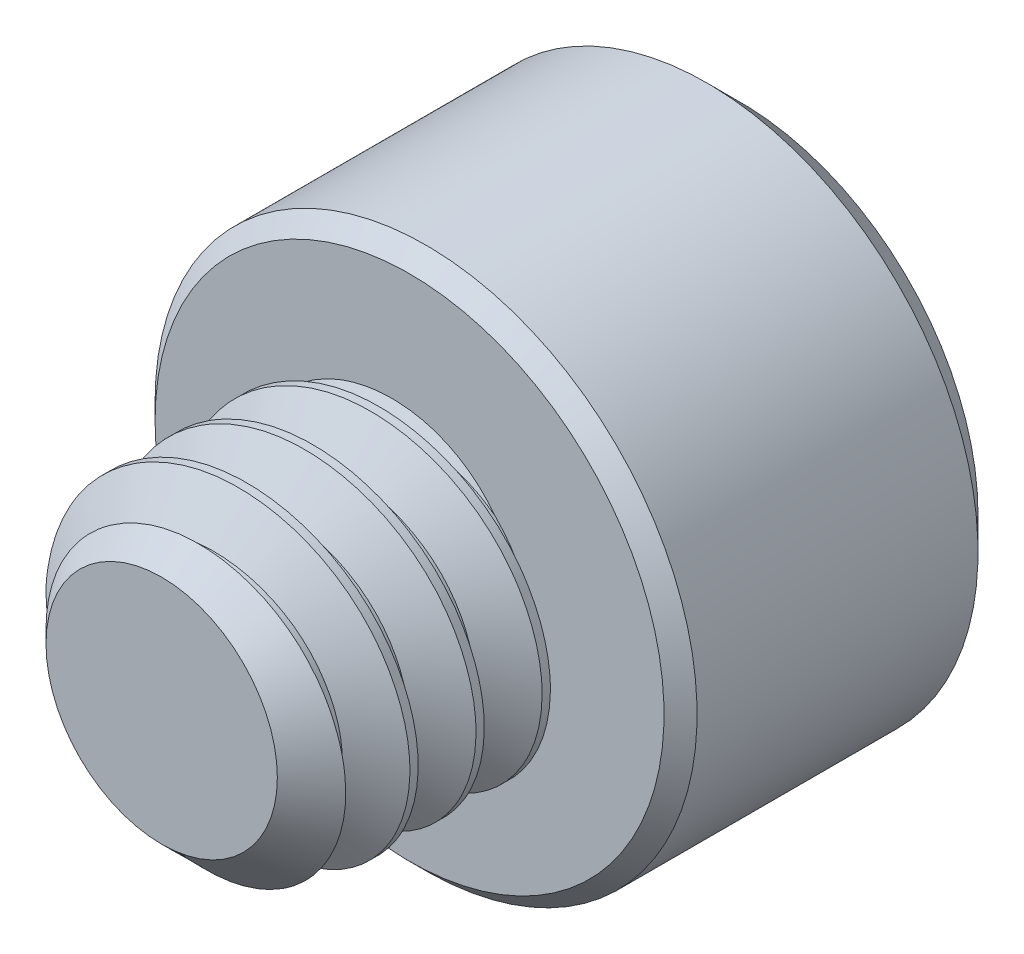
from build123d import *

# Parameters (mm, degrees)
SKETCH1_R          = 1.5875
EXTRUDE1_DEPTH     = 2.38125
CHAMFER3_SIZE      = 0.47625
CUT_SWEEP1_PITCH   = 0.635
SKETCH6_R          = 2.6035
EXTRUDE2_DEPTH     = 3.175
CUT_EXTRUDE1_DEPTH = 1.7859375
SKETCH8_R          = 1.374815329
CUT_EXTRUDE2_DEPTH = 0.3175
CUT_EXTRUDE2_DRAFT = -45
CHAMFER1_SIZE      = 0.3175
CHAMFER2_SIZE      = 0.15875


with BuildPart() as part:
    # Sketch1 → Extrude1 (new body)
    with BuildSketch(Plane.XY):
        Circle(SKETCH1_R)
    extrude(amount=-EXTRUDE1_DEPTH)

    # Chamfer3
    chamfer3_edges = [part.edges().sort_by_distance(p)[0] for p in [
        (-1.5875, 0, 0),
    ]]
    chamfer(chamfer3_edges, length=CHAMFER3_SIZE)

    # Cut-Sweep1: the profile of Sketch3 profile screwed along a right-hand helix of 4.75 turns, 6 arcs to a turn; built about Z, then put on its axis
    cut_sweep1_z = Axis((0, 0, 0), (0, 0, 1))
    cut_sweep1_corners = [(1.5878, 0, -0.555798205), (1.175055401, 0, -0.3175), (1.175055401, 0, -0.238125), (1.5878, 0, 0.000173205)]
    with BuildLine(mode=Mode.PRIVATE) as cut_sweep1_profile:
        Line(cut_sweep1_corners[0], cut_sweep1_corners[1])
        Line(cut_sweep1_corners[1], cut_sweep1_corners[2])
        Line(cut_sweep1_corners[2], cut_sweep1_corners[3])
        Line(cut_sweep1_corners[3], cut_sweep1_corners[0])
    cut_sweep1_cap = Face(cut_sweep1_profile.wire())
    cut_sweep1_turn_angles = [0, 30, 60, 90, 120, 150, 180, 210, 240, 270, 300, 330, 360]
    cut_sweep1_turn_weights = [1, 0.8660254037844387, 1, 0.8660254037844387, 1, 0.8660254037844387, 1, 0.8660254037844387, 1, 0.8660254037844387, 1, 0.8660254037844387, 1]
    cut_sweep1_turn_rails = [Edge.make_bspline([Vector(p[0], p[1], 0).rotate(cut_sweep1_z, cut_sweep1_turn_angles[k]) / cut_sweep1_turn_weights[k] + Vector(0, 0, p[2] + CUT_SWEEP1_PITCH * cut_sweep1_turn_angles[k] / 360) for k in range(13)], [0, 0, 0, 1, 1, 2, 2, 3, 3, 4, 4, 5, 5, 6, 6, 6], 2, cut_sweep1_turn_weights) for p in cut_sweep1_corners]
    cut_sweep1_turn_sides = [Face.make_surface_from_curves(cut_sweep1_turn_rails[p[0]], cut_sweep1_turn_rails[p[1]]) for p in [(0, 1), (1, 2), (2, 3), (3, 0)]]
    cut_sweep1_last_angles = [1440, 1470, 1500, 1530, 1560, 1590, 1620, 1650, 1680, 1695, 1710]
    cut_sweep1_last_weights = [1, 0.8660254037844387, 1, 0.8660254037844387, 1, 0.8660254037844387, 1, 0.8660254037844387, 1, 0.9659258262890595, 1]
    cut_sweep1_last_rails = [Edge.make_bspline([Vector(p[0], p[1], 0).rotate(cut_sweep1_z, cut_sweep1_last_angles[k]) / cut_sweep1_last_weights[k] + Vector(0, 0, p[2] + CUT_SWEEP1_PITCH * cut_sweep1_last_angles[k] / 360) for k in range(11)], [0, 0, 0, 1, 1, 2, 2, 3, 3, 4, 4, 5, 5, 5], 2, cut_sweep1_last_weights) for p in cut_sweep1_corners]
    cut_sweep1_last_sides = [Face.make_surface_from_curves(cut_sweep1_last_rails[p[0]], cut_sweep1_last_rails[p[1]]) for p in [(0, 1), (1, 2), (2, 3), (3, 0)]]
    cut_sweep1 = Plane(origin=(0, 0, 0), x_dir=(0, 1, 0), z_dir=(0, 0, -1)) * Solid(Shell([*[p.moved(Location((0, 0, CUT_SWEEP1_PITCH * i))) for i in range(4) for p in cut_sweep1_turn_sides], *cut_sweep1_last_sides, cut_sweep1_cap, cut_sweep1_cap.rotate(cut_sweep1_z, 1710).moved(Location((0, 0, CUT_SWEEP1_PITCH * 1710 / 360)))]))
    add(cut_sweep1, mode=Mode.SUBTRACT)

    # Sketch6 → Extrude2 (add)
    with BuildSketch(Plane(origin=(0, 0, -2.38125), x_dir=(-1, 0, 0), z_dir=(0, 0, -1))):
        Circle(SKETCH6_R)
    extrude(amount=EXTRUDE2_DEPTH)

    # Sketch7 → Cut-Extrude1 (cut)
    with BuildSketch(Plane(origin=(0, 0, -5.55625), x_dir=(-1, 0, 0), z_dir=(0, 0, -1))):
        Polygon((0, 1.374815329), (-1.190625, 0.687407664), (-1.190625, -0.687407664), (0, -1.374815329), (1.190625, -0.687407664), (1.190625, 0.687407664), align=None)
    extrude(amount=-CUT_EXTRUDE1_DEPTH, mode=Mode.SUBTRACT)


with BuildPart() as cut_extrude2_tool:
    # Sketch8 → Cut-Extrude2 (with draft: the straight prism first)
    with BuildSketch(Plane(origin=(0, 0, -5.55625), x_dir=(-1, 0, 0), z_dir=(0, 0, -1))):
        Circle(SKETCH8_R)
    extrude(amount=-CUT_EXTRUDE2_DEPTH)
    # Cut-Extrude2: the draft: its side faces are tilted about the plane it starts from
    cut_extrude2_sides = [cut_extrude2_tool.faces().sort_by_distance(p)[0] for p in [
        (1.374815329, 0, -5.3975),
    ]]
    draft(cut_extrude2_sides, Plane(origin=(0, 0, -5.55625), x_dir=(-1, 0, 0), z_dir=(0, 0, -1)), CUT_EXTRUDE2_DRAFT)


with BuildPart() as part_1:
    add(part.part)

    # Cut-Extrude2: cut by cut_extrude2_tool
    add(cut_extrude2_tool.part, mode=Mode.SUBTRACT)

    # Chamfer1
    chamfer1_edges = [part_1.edges().sort_by_distance(p)[0] for p in [
        (2.6035, 0, -5.55625),
    ]]
    chamfer(chamfer1_edges, length=CHAMFER1_SIZE)

    # Chamfer2
    chamfer2_edges = [part_1.edges().sort_by_distance(p)[0] for p in [
        (2.6035, 0, -2.38125),
    ]]
    chamfer(chamfer2_edges, length=CHAMFER2_SIZE)


solid = part_1.part
